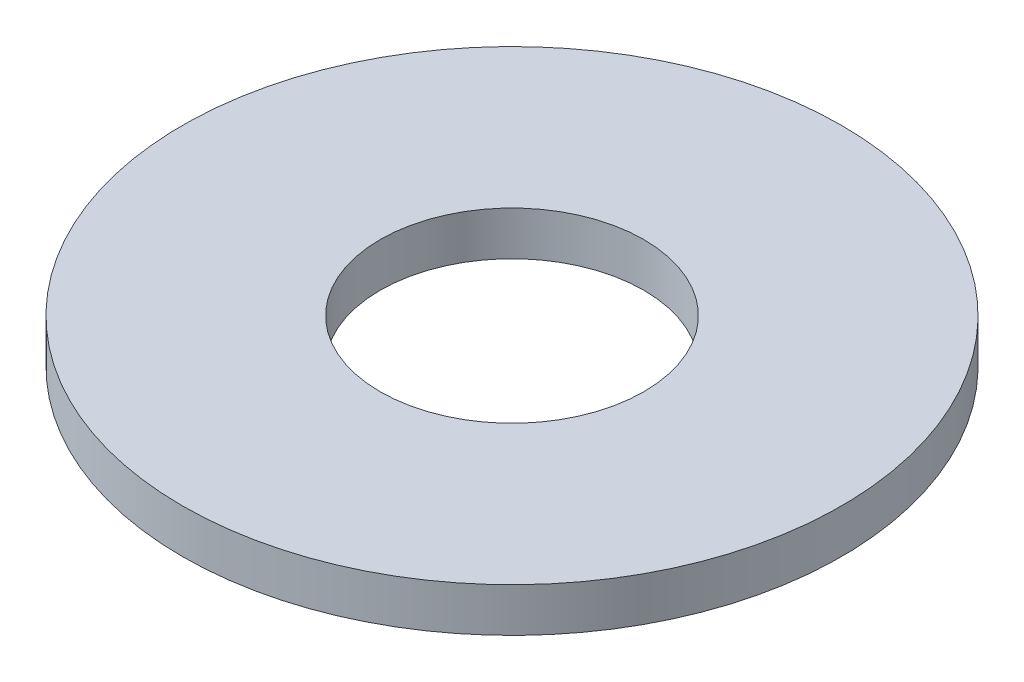
from build123d import *

# Parameters (mm, degrees)
SKETCH1_R           = 75
BOSS_EXTRUDE1_DEPTH = 10
SKETCH2_R           = 30
CUT_EXTRUDE1_DEPTH  = 107.536378763


with BuildPart() as part:
    # Sketch1 → Boss-Extrude1 (new body)
    with BuildSketch(Plane(origin=(0, 0, 0), x_dir=(1, 0, 0), z_dir=(0, 1, 0))):
        Circle(SKETCH1_R)
    extrude(amount=BOSS_EXTRUDE1_DEPTH)

    # Sketch2 → Cut-Extrude1 (cut, through all)
    with BuildSketch(Plane(origin=(0, 0, 0), x_dir=(1, 0, 0), z_dir=(0, 1, 0))):
        Circle(SKETCH2_R)
    extrude(amount=CUT_EXTRUDE1_DEPTH, mode=Mode.SUBTRACT)


solid = part.part
